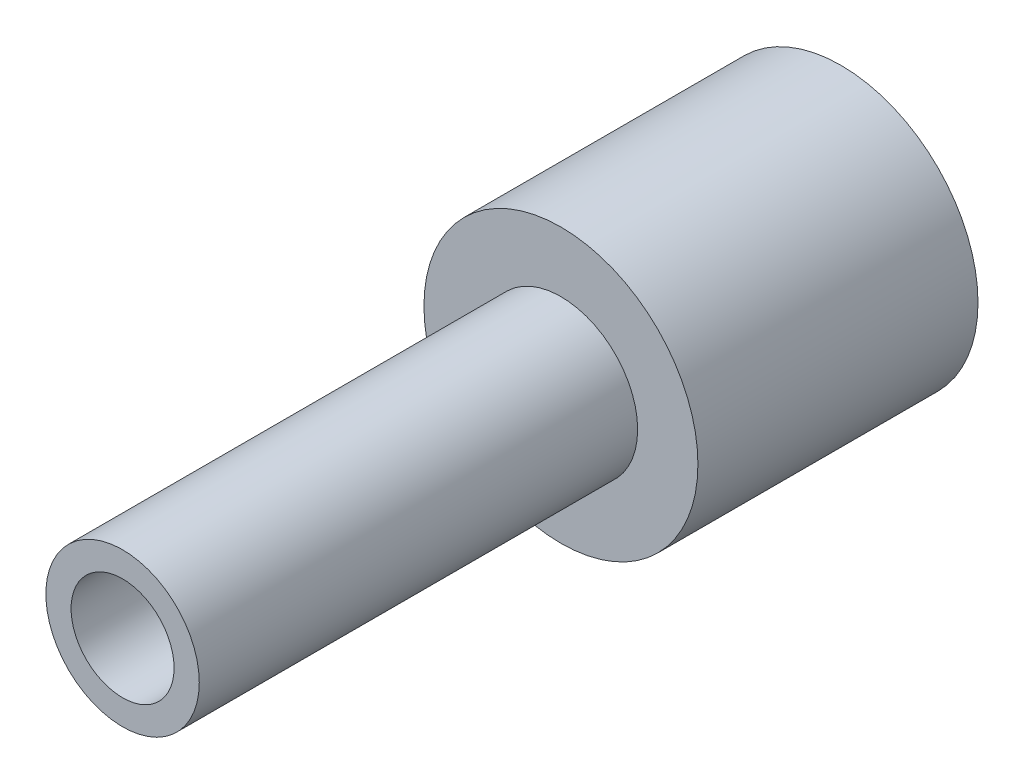
from build123d import *

# Parameters (mm, degrees)
SKETCH1_R           = 3.175
BOSS_EXTRUDE1_DEPTH = 17.526
SKETCH2_OUTSIDE_W   = 12.288
SKETCH2_OUTSIDE_H   = 12.288
SKETCH2_OUTSIDE_R   = 1.778
CUT_EXTRUDE1_DEPTH  = 10.16
SKETCH3_R           = 1.1938
CUT_EXTRUDE2_DEPTH  = 10.16
SKETCH5_R           = 0.635
CUT_EXTRUDE3_DEPTH  = 7.62
CHAMFER1_SIZE       = 0.874592138
CHAMFER1_SIZE_2     = 2.54


with BuildPart() as part:
    # Sketch1 → Boss-Extrude1 (new body)
    with BuildSketch(Plane.XY):
        Circle(SKETCH1_R)
    extrude(amount=BOSS_EXTRUDE1_DEPTH)

    # Sketch2 outside → Cut-Extrude1 (cut)
    with BuildSketch(Plane.XY.offset(17.526)):
        Rectangle(SKETCH2_OUTSIDE_W, SKETCH2_OUTSIDE_H)
        Circle(SKETCH2_OUTSIDE_R, mode=Mode.SUBTRACT)
    extrude(amount=-CUT_EXTRUDE1_DEPTH, mode=Mode.SUBTRACT)

    # Sketch3 → Cut-Extrude2 (cut)
    with BuildSketch(Plane.XY.offset(17.526)):
        Circle(SKETCH3_R)
    extrude(amount=-CUT_EXTRUDE2_DEPTH, mode=Mode.SUBTRACT)

    # Sketch5 → Cut-Extrude3 (cut)
    with BuildSketch(Plane(origin=(0, 0, 0), x_dir=(-1, 0, 0), z_dir=(0, 0, -1))):
        Circle(SKETCH5_R)
    extrude(amount=-CUT_EXTRUDE3_DEPTH, mode=Mode.SUBTRACT)

    # Chamfer1
    # the kernel refuses this chamfer: 2.54, 0.874592138 mm, written as the material it takes off along each edge
    with BuildSketch(Plane(origin=(0, 0, 0), x_dir=(1, 0, 0), z_dir=(0, -1, 0))) as chamfer1_piece_1:
        Polygon((3.175, CHAMFER1_SIZE), (3.175 - CHAMFER1_SIZE_2, 0), (3.175, 0), align=None)
    revolve(axis=Axis((0, 0, 0), (0, 0, 1)), mode=Mode.SUBTRACT)


solid = part.part
